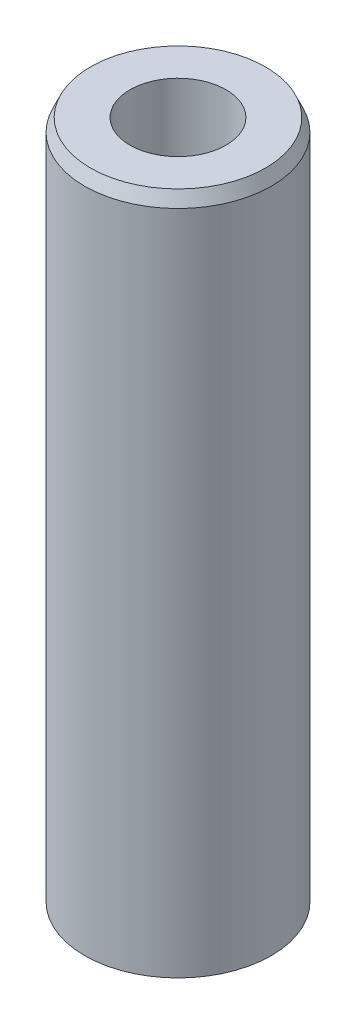
from build123d import *
from OCP.BRepFilletAPI import BRepFilletAPI_MakeChamfer

# Parameters (mm, degrees)
SKETCH1_R           = 5
BOSS_EXTRUDE1_DEPTH = 36.699047479
SKETCH2_R           = 2.574379866
CUT_EXTRUDE1_DEPTH  = 38.374056321
CHAMFER1_SIZE       = 0.691405501
CHAMFER1_SIZE2      = 0.307802333


with BuildPart() as part:
    # Sketch1 → Boss-Extrude1 (new body)
    with BuildSketch(Plane(origin=(0, 0, 0), x_dir=(1, 0, 0), z_dir=(0, 1, 0))):
        Circle(SKETCH1_R)
    extrude(amount=BOSS_EXTRUDE1_DEPTH)

    # Sketch2 → Cut-Extrude1 (cut, through all)
    with BuildSketch(Plane(origin=(0, 0, 0), x_dir=(1, 0, 0), z_dir=(0, 1, 0))):
        Circle(SKETCH2_R)
    extrude(amount=CUT_EXTRUDE1_DEPTH, mode=Mode.SUBTRACT)

    # Chamfer1: one chamfer whose edges measure the first distance from different faces: ONE call of the kernel's chamfer builder (chamfer() names one face for all edges)
    chamfer1_edges_1 = [part.edges().sort_by_distance(p)[0] for p in [
        (-5, 36.699047479, 0),
    ]]
    chamfer1_side_1 = [part.faces().sort_by_distance(p)[0] for p in [
        (-5, 18.34952374, 0),
    ]]
    chamfer1_edges_2 = [part.edges().sort_by_distance(p)[0] for p in [
        (-5, 0, 0),
    ]]
    chamfer1_side_2 = [part.faces().sort_by_distance(p)[0] for p in [
        (-4.858578644, 0, 0),
    ]]
    chamfer1 = BRepFilletAPI_MakeChamfer(part.part.solid().wrapped)
    for e in chamfer1_edges_1:
        chamfer1.Add(CHAMFER1_SIZE, CHAMFER1_SIZE2, e.wrapped, chamfer1_side_1[0].wrapped)  # the first distance lies on this face
    for e in chamfer1_edges_2:
        chamfer1.Add(CHAMFER1_SIZE, CHAMFER1_SIZE2, e.wrapped, chamfer1_side_2[0].wrapped)  # the first distance lies on this face
    add(Compound.cast(chamfer1.Shape()), mode=Mode.REPLACE)


solid = part.part
